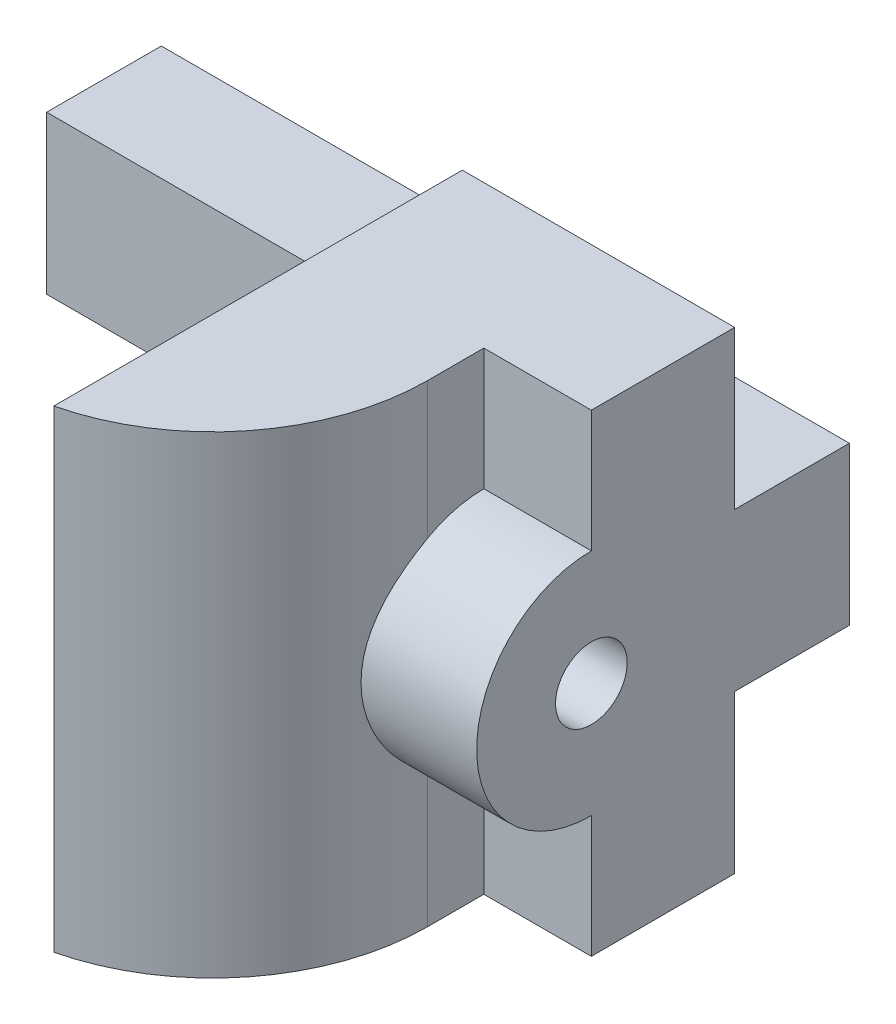
from build123d import *

# Parameters (mm, degrees)
SKETCH1_R               = 5
BOSS_EXTRUDE1_DEPTH     = 15
SKETCH1_3_W             = 22
SKETCH1_3_H             = 16
BOSS_EXTRUDE2_DEPTH     = 96
SKETCH2_W               = 23
SKETCH2_H               = 57
BOSS_EXTRUDE3_DEPTH     = 66
FILLET1_R               = 30
CUT_EXTRUDE1_DEPTH      = 109.046286442
CUT_EXTRUDE1_DEPTH_BACK = 109.046286442
SKETCH1_4_R             = 5


with BuildPart() as part:
    # Sketch1 → Boss-Extrude1 (new body)
    with BuildSketch(Plane.YZ):
        with BuildLine():
            Line((16, 0), (33, 0))
            Line((33, 0), (33, -20))
            Line((33, -20), (11, -20))
            Line((11, -20), (-11, -20))
            Line((-11, -20), (-33, -20))
            Line((-33, -20), (-33, 0))
            Line((-33, 0), (-16, 0))
            ThreePointArc((-16, 0), (0, 16), (16, 0))
        make_face()
        with Locations(Location((0, 0, 0), (0, 0, 270))):
            Circle(SKETCH1_R, mode=Mode.SUBTRACT)
    extrude(amount=-BOSS_EXTRUDE1_DEPTH)

    # Sketch1<3> → Boss-Extrude2 (add)
    with BuildSketch(Plane.YZ):
        with Locations((0, -28)):
            Rectangle(SKETCH1_3_W, SKETCH1_3_H)
    extrude(amount=-BOSS_EXTRUDE2_DEPTH)

    # Sketch2 → Boss-Extrude3 (add)
    with BuildSketch(Plane(origin=(0, 33, 0), x_dir=(-1, 0, 0), z_dir=(0, 1, 0))):
        with Locations((26.5, 8.5)):
            Rectangle(SKETCH2_W, SKETCH2_H)
    extrude(amount=-BOSS_EXTRUDE3_DEPTH)

    # Fillet1
    # the kernel refuses this fillet: 30 mm, written as the material it takes off along each edge
    with BuildSketch(Plane(origin=(-15, 105.929760729, 37), x_dir=(0, 0, -1), z_dir=(0, -1, 0))) as fillet1_piece_1_section:
        with BuildLine():
            CenterArc((29.171904292, -30), FILLET1_R, 90, 76.506601178)
            Line((0, -23), (0, 0))
            Line((0, 0), (29.171904292, 0))
        make_face()
    fillet1_piece_1 = extrude(amount=211.859521458, mode=Mode.PRIVATE)
    fillet1_piece_1 = fillet1_piece_1 - Plane(origin=(-15, 0, 0), x_dir=(0, -1, 0), z_dir=(1, 0, 0)) * Cylinder(16, 541, mode=Mode.PRIVATE)
    add(fillet1_piece_1, mode=Mode.SUBTRACT)

    # Sketch1<4> → Cut-Extrude1 (cut, two sides: drawn at the far end of the back side and taken through both)
    with BuildSketch(Plane.YZ.offset(-CUT_EXTRUDE1_DEPTH_BACK)):
        with Locations(Location((0, 0, 0), (0, 0, 270))):
            Circle(SKETCH1_4_R)
    extrude(amount=CUT_EXTRUDE1_DEPTH + CUT_EXTRUDE1_DEPTH_BACK, mode=Mode.SUBTRACT)


solid = part.part
